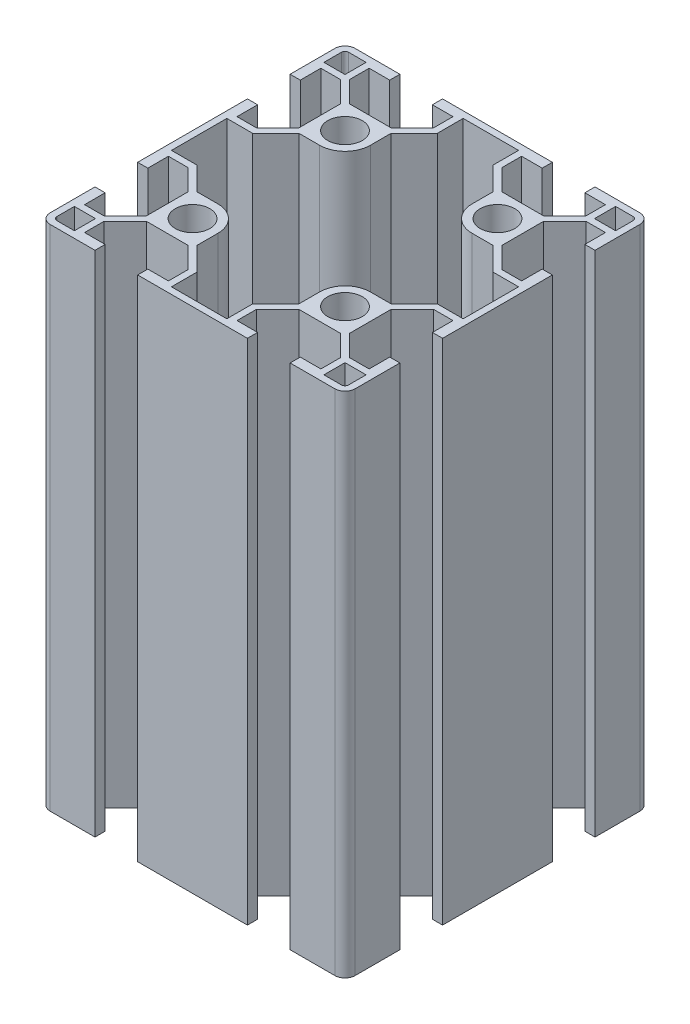
from build123d import *

# Parameters (mm, degrees)
SKETCH_1_W      = 4.15
SKETCH_1_H      = 4.15
SKETCH_1_R      = 3.4
EXTRUDE_1_DEPTH = 100
FILLET_1_R      = 0.7
FILLET_2_R      = 2
FILLET_3_R      = 5


with BuildPart() as part:
    # 草图1 → 凸台-拉伸1 (new body)
    with BuildSketch(Plane(origin=(0, 0, 0), x_dir=(1, 0, 0), z_dir=(0, 1, 0))):
        Polygon((-19.2, 30), (-30, 30), (-30, 19.2), (-28, 19.2), (-28, 23.25), (-24.169238816, 23.25), (-20, 19.080761184), (-20, 10.919238816), (-24.169238816, 6.75), (-28, 6.75), (-28, 10.8), (-30, 10.8), (-30, -10.8), (-28, -10.8), (-28, -6.75), (-24.169238816, -6.75), (-20, -10.919238816), (-20, -19.080761184), (-24.169238816, -23.25), (-28, -23.25), (-28, -19.2), (-30, -19.2), (-30, -30), (-19.2, -30), (-19.2, -28), (-23.25, -28), (-23.25, -24.169238816), (-19.080761184, -20), (-10.919238816, -20), (-6.75, -24.169238816), (-6.75, -28), (-10.8, -28), (-10.8, -30), (10.8, -30), (10.8, -28), (6.75, -28), (6.75, -24.169238816), (10.919238816, -20), (19.080761184, -20), (23.25, -24.169238816), (23.25, -28), (19.2, -28), (19.2, -30), (30, -30), (30, -19.2), (28, -19.2), (28, -23.25), (24.169238816, -23.25), (20, -19.080761184), (20, -10.919238816), (24.169238816, -6.75), (28, -6.75), (28, -10.8), (30, -10.8), (30, 10.8), (28, 10.8), (28, 6.75), (24.169238816, 6.75), (20, 10.919238816), (20, 19.080761184), (24.169238816, 23.25), (28, 23.25), (28, 19.2), (30, 19.2), (30, 30), (19.2, 30), (19.2, 28), (23.25, 28), (23.25, 24.169238816), (19.080761184, 20), (10.919238816, 20), (6.75, 24.169238816), (6.75, 28), (10.8, 28), (10.8, 30), (-10.8, 30), (-10.8, 28), (-6.75, 28), (-6.75, 24.169238816), (-10.919238816, 20), (-19.080761184, 20), (-23.25, 24.169238816), (-23.25, 28), (-19.2, 28), align=None)
        with Locations((-26.625, -26.625)):
            Rectangle(SKETCH_1_W, SKETCH_1_H, mode=Mode.SUBTRACT)
        with Locations((-15, -15)):
            Circle(SKETCH_1_R, mode=Mode.SUBTRACT)
        with Locations((26.625, -26.625)):
            Rectangle(SKETCH_1_W, SKETCH_1_H, mode=Mode.SUBTRACT)
        with Locations((15, -15)):
            Circle(SKETCH_1_R, mode=Mode.SUBTRACT)
        with Locations((-15, 15)):
            Circle(SKETCH_1_R, mode=Mode.SUBTRACT)
        with Locations((-26.625, 26.625)):
            Rectangle(SKETCH_1_W, SKETCH_1_H, mode=Mode.SUBTRACT)
        Polygon((-5.45, 23.630761184), (-5.45, 28), (-5.45, 28.7), (5.45, 28.7), (5.45, 28), (5.45, 23.630761184), (10, 19.080761184), (10, 10), (19.080761184, 10), (23.630761184, 5.45), (28, 5.45), (28.7, 5.45), (28.7, -5.45), (28, -5.45), (23.630761184, -5.45), (19.080761184, -10), (10, -10), (10, -19.080761184), (5.45, -23.630761184), (5.45, -28), (5.45, -28.7), (-5.45, -28.7), (-5.45, -28), (-5.45, -23.630761184), (-10, -19.080761184), (-10, -10), (-19.080761184, -10), (-23.630761184, -5.45), (-28, -5.45), (-28.7, -5.45), (-28.7, 5.45), (-28, 5.45), (-23.630761184, 5.45), (-19.080761184, 10), (-10, 10), (-10, 19.080761184), align=None, mode=Mode.SUBTRACT)
        with Locations((15, 15)):
            Circle(SKETCH_1_R, mode=Mode.SUBTRACT)
        with Locations((26.625, 26.625)):
            Rectangle(SKETCH_1_W, SKETCH_1_H, mode=Mode.SUBTRACT)
    extrude(amount=EXTRUDE_1_DEPTH)

    # 圆角1
    fillet_1_edges = [part.edges().sort_by_distance(p)[0] for p in [
        (-28.7, 50, 28.7),
        (-28.7, 50, -28.7),
        (28.7, 50, -28.7),
        (28.7, 50, 28.7),
    ]]
    fillet(fillet_1_edges, radius=FILLET_1_R)

    # 圆角2
    fillet_2_edges = [part.edges().sort_by_distance(p)[0] for p in [
        (30, 50, 30),
        (-30, 50, 30),
        (-30, 50, -30),
        (30, 50, -30),
    ]]
    fillet(fillet_2_edges, radius=FILLET_2_R)

    # 圆角3
    fillet_3_edges = [part.edges().sort_by_distance(p)[0] for p in [
        (10, 50, 10),
        (10, 50, -10),
        (-10, 50, -10),
        (-10, 50, 10),
    ]]
    fillet(fillet_3_edges, radius=FILLET_3_R)


solid = part.part
